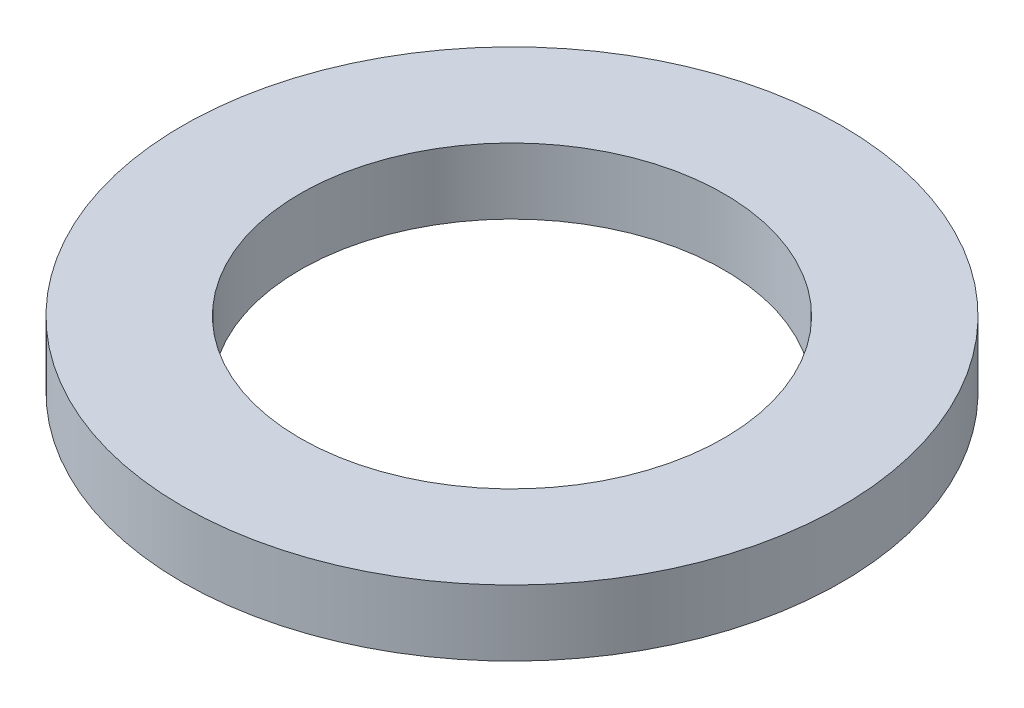
from build123d import *

# Parameters (mm, degrees)
SKETCH1_R           = 70
BOSS_EXTRUDE1_DEPTH = 14
SKETCH2_R           = 45
CUT_EXTRUDE1_DEPTH  = 100.979998


with BuildPart() as part:
    # Sketch1 → Boss-Extrude1 (new body)
    with BuildSketch(Plane(origin=(0, 0, 0), x_dir=(1, 0, 0), z_dir=(0, 1, 0))):
        Circle(SKETCH1_R)
    extrude(amount=BOSS_EXTRUDE1_DEPTH)

    # Sketch2 → Cut-Extrude1 (cut, through all)
    with BuildSketch(Plane(origin=(0, 0, 0), x_dir=(1, 0, 0), z_dir=(0, 1, 0))):
        Circle(SKETCH2_R)
    extrude(amount=CUT_EXTRUDE1_DEPTH, mode=Mode.SUBTRACT)


solid = part.part
